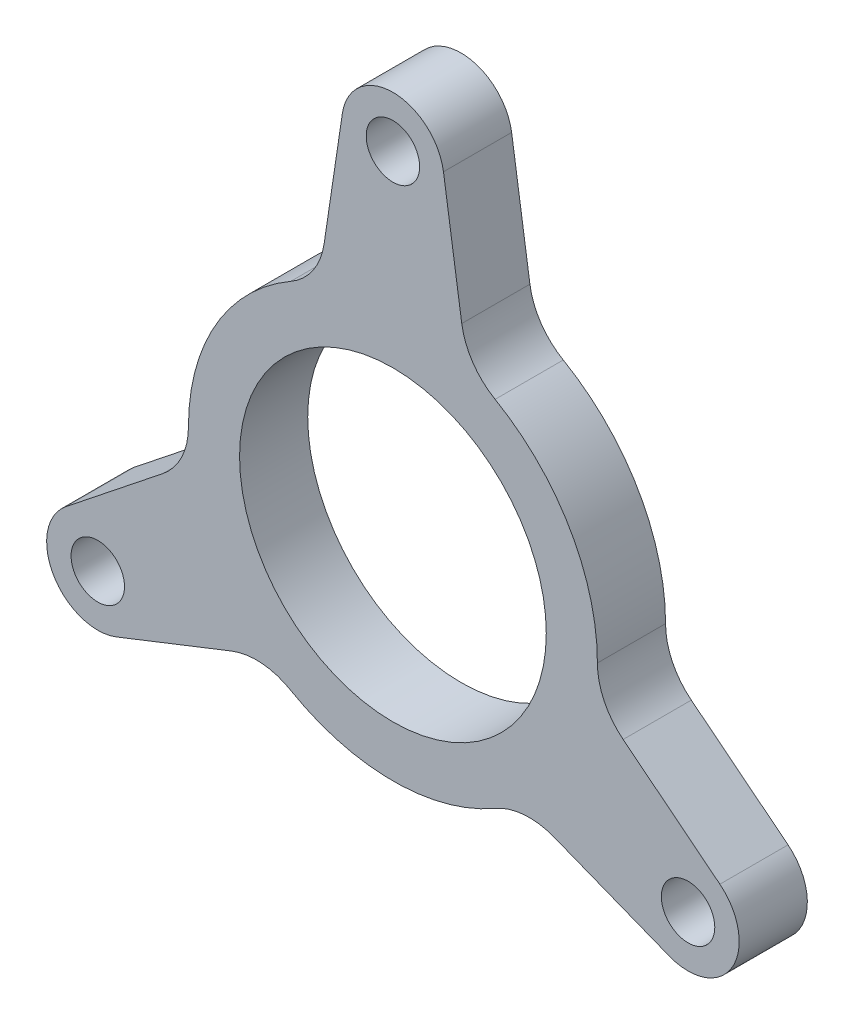
from build123d import *

# Parameters (mm, degrees)
SKETCH2_R           = 2.4892
SKETCH2_R_2         = 14.2875
BOSS_EXTRUDE1_DEPTH = 6.35
FILLET2_R           = 6.35


with BuildPart() as part:
    # Sketch2 → Boss-Extrude1 (new body)
    with BuildSketch(Plane.XY):
        with BuildLine():
            Line((6.907154609, 17.753695818), (4.710188049, 32.453942321))
            ThreePointArc((4.710188049, 32.453942321), (0, 36.5125), (-4.710188049, 32.453942321))
            Line((-4.710188049, 32.453942321), (-6.907154609, 17.753695818))
            ThreePointArc((-6.907154609, 17.753695818), (-16.497783942, 9.525), (-18.828728894, -2.89507655))
            Line((-18.828728894, -2.89507655), (-30.461032527, -12.147828653))
            ThreePointArc((-30.461032527, -12.147828653), (-31.620752556, -18.25625), (-25.750844478, -20.306113668))
            Line((-25.750844478, -20.306113668), (-11.921574285, -14.858619268))
            ThreePointArc((-11.921574285, -14.858619268), (0, -19.05), (11.921574285, -14.858619268))
            Line((11.921574285, -14.858619268), (25.750844478, -20.306113668))
            ThreePointArc((25.750844478, -20.306113668), (31.620752556, -18.25625), (30.461032527, -12.147828653))
            Line((30.461032527, -12.147828653), (18.828728894, -2.89507655))
            ThreePointArc((18.828728894, -2.89507655), (16.497783942, 9.525), (6.907154609, 17.753695818))
        make_face()
        with Locations((0, 31.75)):
            Circle(SKETCH2_R, mode=Mode.SUBTRACT)
        Circle(SKETCH2_R_2, mode=Mode.SUBTRACT)
        with Locations((27.49630657, -15.875)):
            Circle(SKETCH2_R, mode=Mode.SUBTRACT)
        with Locations((-27.49630657, -15.875)):
            Circle(SKETCH2_R, mode=Mode.SUBTRACT)
    extrude(amount=BOSS_EXTRUDE1_DEPTH)

    # Fillet2
    fillet2_edges = [part.edges().sort_by_distance(p)[0] for p in [
        (18.828728894, -2.89507655, 3.175),
        (11.921574285, -14.858619268, 3.175),
        (-11.921574285, -14.858619268, 3.175),
        (-18.828728894, -2.89507655, 3.175),
        (-6.907154609, 17.753695818, 3.175),
        (6.907154609, 17.753695818, 3.175),
    ]]
    fillet(fillet2_edges, radius=FILLET2_R)


solid = part.part
